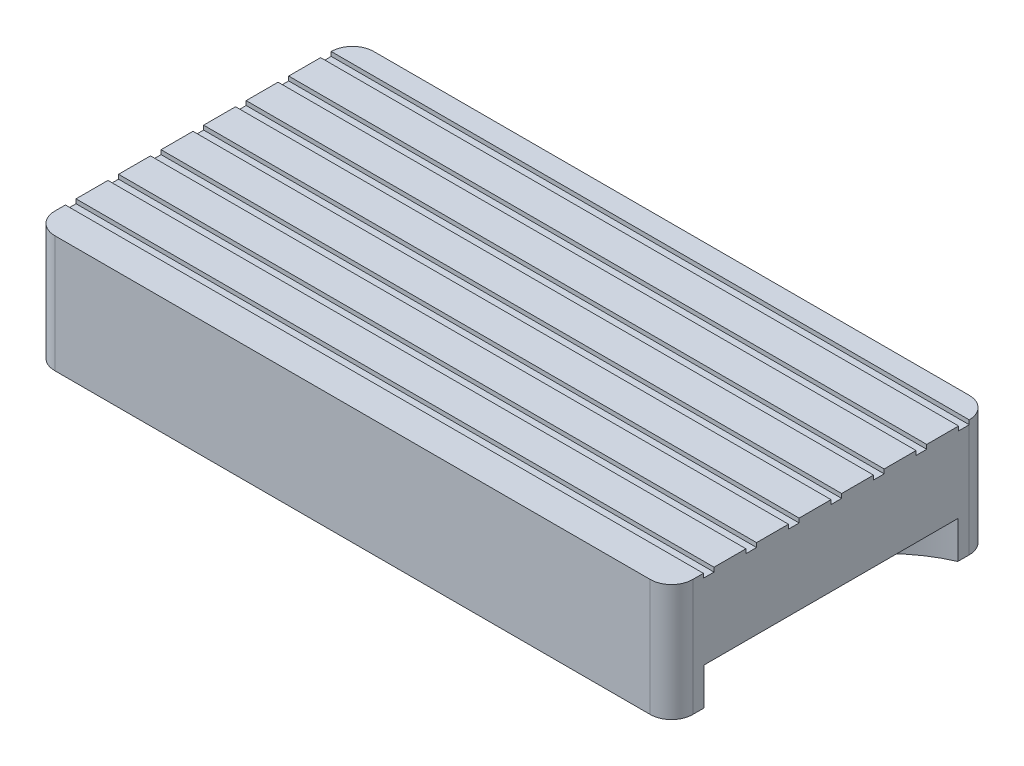
from build123d import *

# Parameters (mm, degrees)
SKETCH1_W               = 30
SKETCH1_H               = 15
BOSS_EXTRUDE1_DEPTH     = 5.5
CUT_EXTRUDE2_DEPTH      = 18.649362595
CUT_EXTRUDE2_DEPTH_BACK = 18.649362595
SKETCH2_W               = 0.5
SKETCH2_H               = 0.2
SKETCH7_R               = 6.5
CUT_EXTRUDE6_DEPTH      = 1.75
FILLET1_R               = 1


with BuildPart() as part:
    # Sketch1 → Boss-Extrude1 (new body)
    with BuildSketch(Plane(origin=(0, 0, 0), x_dir=(1, 0, 0), z_dir=(0, 1, 0))):
        Rectangle(SKETCH1_W, SKETCH1_H)
    extrude(amount=BOSS_EXTRUDE1_DEPTH)

    # Sketch2 → Cut-Extrude2 (cut, two sides: drawn at the far end of the back side and taken through both)
    with BuildSketch(Plane(origin=(0, 0, 0), x_dir=(0, 0, -1), z_dir=(1, 0, 0)).offset(-CUT_EXTRUDE2_DEPTH_BACK)):
        with Locations((-5.75, 5.4)):
            Rectangle(SKETCH2_W, SKETCH2_H)
        with Locations((-3.75, 5.4)):
            Rectangle(SKETCH2_W, SKETCH2_H)
        with Locations((-1.75, 5.4)):
            Rectangle(SKETCH2_W, SKETCH2_H)
        with Locations((0.25, 5.4)):
            Rectangle(SKETCH2_W, SKETCH2_H)
        with Locations((2.25, 5.4)):
            Rectangle(SKETCH2_W, SKETCH2_H)
        with Locations((4.25, 5.4)):
            Rectangle(SKETCH2_W, SKETCH2_H)
        with Locations((6.25, 5.4)):
            Rectangle(SKETCH2_W, SKETCH2_H)
    extrude(amount=CUT_EXTRUDE2_DEPTH + CUT_EXTRUDE2_DEPTH_BACK, mode=Mode.SUBTRACT)

    # Sketch8 → Cut-Revolve1 (revolve, cut)
    with BuildSketch(Plane.XY.offset(4), mode=Mode.PRIVATE) as cut_revolve1_sk:
        Polygon((10.25, 0), (10.25, 3), (9, 3.721687836), (9, 0), align=None)
    cut_revolve1 = revolve(cut_revolve1_sk.sketch.rotate(Axis((9, 0, 4), (0, 1, 0)), 90), axis=Axis((9, 0, 4), (0, 1, 0)), mode=Mode.SUBTRACT)

    # Mirror1: Cut-Revolve1 across plane
    add(cut_revolve1.mirror(Plane.XY), mode=Mode.SUBTRACT)

    # Mirror2: Cut-Revolve1 across plane
    add(cut_revolve1.mirror(Plane(origin=(0, 0, 0), x_dir=(0, 0, 1), z_dir=(1, 0, 0))), mode=Mode.SUBTRACT)

    # Mirror2 copy 1 sketch → Mirror2 copy 1 (revolve, cut)
    with BuildSketch(Plane(origin=(0, 0, -4), x_dir=(-1, 0, 0), z_dir=(0, 0, -1))):
        Polygon((10.25, 0), (10.25, 3), (9, 3.721687836), (9, 0), align=None)
    revolve(axis=Axis((-9, 0, -4), (0, 1, 0)), mode=Mode.SUBTRACT)

    # Sketch9 → Cut-Revolve2 (revolve, cut)
    with BuildSketch(Plane.XY, mode=Mode.PRIVATE) as cut_revolve2_sk:
        Polygon((-15, 2.5), (-7.678312164, 2.5), (-8.4, 3.75), (-15, 3.75), align=None)
    revolve(cut_revolve2_sk.sketch.rotate(Axis((-15, 2.5, 0), (-1, 0, 0)), 180), axis=Axis((-15, 2.5, 0), (-1, 0, 0)), mode=Mode.SUBTRACT)

    # Sketch7 → Cut-Extrude6 (cut)
    with BuildSketch(Plane.XZ):
        with Locations((17.59, 0)):
            Circle(SKETCH7_R)
    extrude(amount=-CUT_EXTRUDE6_DEPTH, mode=Mode.SUBTRACT)

    # Fillet1
    fillet1_edges = [part.edges().sort_by_distance(p)[0] for p in [
        (-15, 2.75, -7.5),
        (15, 2.75, -7.5),
        (15, 2.75, 7.5),
        (-15, 2.75, 7.5),
    ]]
    fillet(fillet1_edges, radius=FILLET1_R - 0.0001)  # a hair under: the kernel refuses the full size


solid = part.part
